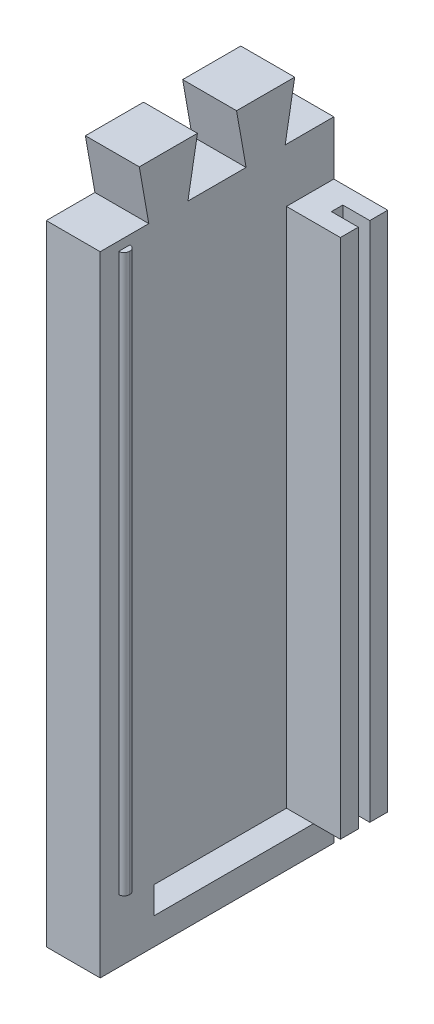
from build123d import *

# Parameters (mm, degrees)
BOSS_EXTRUDE2_DEPTH = 30
SKETCH1_3_W         = 6.2
SKETCH1_3_H         = 310
BOSS_EXTRUDE3_DEPTH = 3
FILLET2_R           = 3
CUT_EXTRUDE1_DEPTH  = 15
SKETCH1_7_W         = 26.35
SKETCH1_7_H         = 290
BOSS_EXTRUDE6_DEPTH = 30
SKETCH4_W           = 6.35
SKETCH4_H           = 290
CUT_EXTRUDE4_DEPTH  = 15


with BuildPart() as part:
    # Sketch1 → Boss-Extrude2 (new body)
    with BuildSketch(Plane(origin=(0, 0, 0), x_dir=(0, 0, -1), z_dir=(1, 0, 0))):
        Polygon((-37.942, 160), (-65, 160), (-65, -190), (65, -190), (65, 160), (37.942, 160), (43.232, 190), (10.884, 190), (16.174, 160), (-16.174, 160), (-10.884, 190), (-43.232, 190), align=None)
    extrude(amount=-BOSS_EXTRUDE2_DEPTH)

    # Sketch1<5> → Cut-Extrude1 (cut)
    with BuildSketch(Plane(origin=(0, 0, 0), x_dir=(0, 0, -1), z_dir=(1, 0, 0))):
        Polygon((38.65, -160), (-35, -160), (-35, -175), (65, -175), (65, -160), align=None)
    extrude(amount=-CUT_EXTRUDE1_DEPTH, mode=Mode.SUBTRACT)

    # Sketch1<7> → Boss-Extrude6 (add)
    with BuildSketch(Plane(origin=(0, 0, 0), x_dir=(0, 0, -1), z_dir=(1, 0, 0))):
        with Locations((51.825, -15)):
            Rectangle(SKETCH1_7_W, SKETCH1_7_H)
    extrude(amount=BOSS_EXTRUDE6_DEPTH)

    # Sketch4 → Cut-Extrude4 (cut)
    with BuildSketch(Plane(origin=(30, 0, 0), x_dir=(0, 0, -1), z_dir=(1, 0, 0))):
        with Locations((51.825, -15)):
            Rectangle(SKETCH4_W, SKETCH4_H)
    extrude(amount=-CUT_EXTRUDE4_DEPTH, mode=Mode.SUBTRACT)


with BuildPart() as body_2:
    # Sketch1<3> → Boss-Extrude3 (new body)
    with BuildSketch(Plane(origin=(0, 0, 0), x_dir=(0, 0, -1), z_dir=(1, 0, 0))):
        with Locations((-51.56, 0)):
            Rectangle(SKETCH1_3_W, SKETCH1_3_H)
    extrude(amount=BOSS_EXTRUDE3_DEPTH)

    # Fillet2
    fillet2_edges = [body_2.edges().sort_by_distance(p)[0] for p in [
        (3, 0, 48.46),
        (3, 0, 54.66),
    ]]
    fillet(fillet2_edges, radius=FILLET2_R - 0.0001)  # a hair under: the kernel refuses the full size


solid = Compound([part.part, body_2.part])
